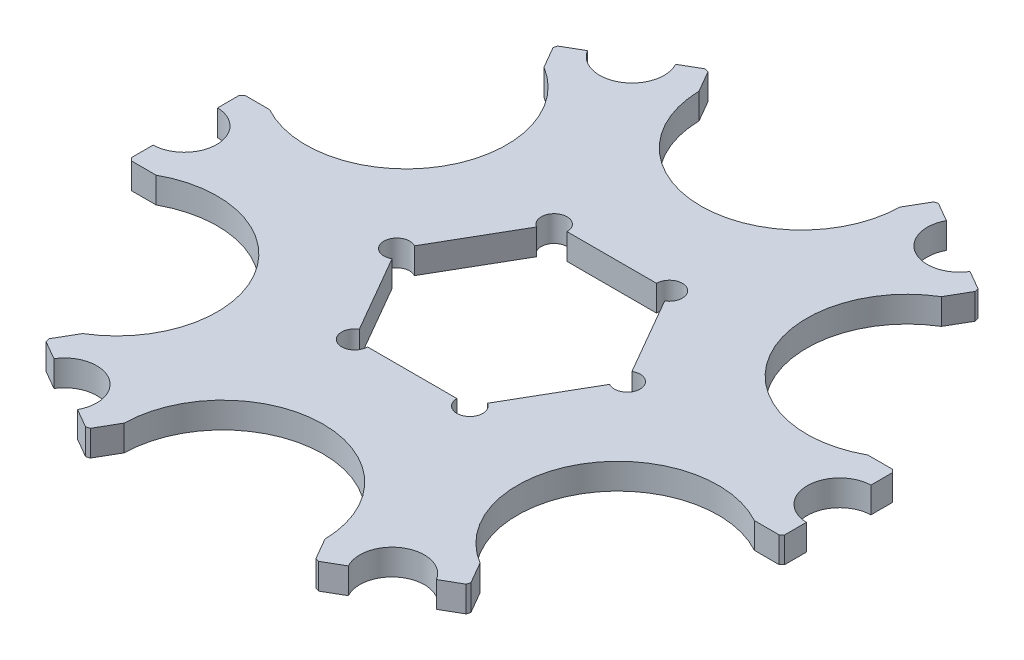
from build123d import *

# Parameters (mm, degrees)
BOSS_EXTRUDE1_DEPTH = 4.7625
CHAMFER1_SIZE       = 0.508


with BuildPart() as part:
    # Sketch1 → Boss-Extrude1 (new body)
    with BuildSketch(Plane(origin=(0, 0, 0), x_dir=(1, 0, 0), z_dir=(0, 1, 0))):
        with BuildLine():
            Line((-55.1561, 10.4648), (-60.2361, 10.4648))
            Line((-60.2361, 10.4648), (-60.2361, 5.950469261))
            ThreePointArc((-60.2361, 5.950469261), (-54.460775, 0), (-60.2361, -5.950469261))
            Line((-60.2361, -5.950469261), (-60.2361, -10.4648))
            Line((-60.2361, -10.4648), (-55.1561, -10.4648))
            ThreePointArc((-55.1561, -10.4648), (-30.156383683, -17.410796237), (-36.640832646, -42.534183774))
            Line((-36.640832646, -42.534183774), (-39.180832646, -46.933592825))
            Line((-39.180832646, -46.933592825), (-35.271307544, -49.190758194))
            ThreePointArc((-35.271307544, -49.190758194), (-27.2303875, -47.16441466), (-24.964792456, -55.141227455))
            Line((-24.964792456, -55.141227455), (-21.055267354, -57.398392825))
            Line((-21.055267354, -57.398392825), (-18.515267354, -52.998983774))
            ThreePointArc((-18.515267354, -52.998983774), (0, -34.821592475), (18.515267354, -52.998983774))
            Line((18.515267354, -52.998983774), (21.055267354, -57.398392825))
            Line((21.055267354, -57.398392825), (24.964792456, -55.141227455))
            ThreePointArc((24.964792456, -55.141227455), (27.2303875, -47.16441466), (35.271307544, -49.190758194))
            Line((35.271307544, -49.190758194), (39.180832646, -46.933592825))
            Line((39.180832646, -46.933592825), (36.640832646, -42.534183774))
            ThreePointArc((36.640832646, -42.534183774), (30.156383683, -17.410796237), (55.1561, -10.4648))
            Line((55.1561, -10.4648), (60.2361, -10.4648))
            Line((60.2361, -10.4648), (60.2361, -5.950469261))
            ThreePointArc((60.2361, -5.950469261), (54.460775, 0), (60.2361, 5.950469261))
            Line((60.2361, 5.950469261), (60.2361, 10.4648))
            Line((60.2361, 10.4648), (55.1561, 10.4648))
            ThreePointArc((55.1561, 10.4648), (30.156383683, 17.410796237), (36.640832646, 42.534183774))
            Line((36.640832646, 42.534183774), (39.180832646, 46.933592825))
            Line((39.180832646, 46.933592825), (35.271307544, 49.190758194))
            ThreePointArc((35.271307544, 49.190758194), (27.2303875, 47.16441466), (24.964792456, 55.141227455))
            Line((24.964792456, 55.141227455), (21.055267354, 57.398392825))
            Line((21.055267354, 57.398392825), (18.515267354, 52.998983774))
            ThreePointArc((18.515267354, 52.998983774), (0, 34.821592475), (-18.515267354, 52.998983774))
            Line((-18.515267354, 52.998983774), (-21.055267354, 57.398392825))
            Line((-21.055267354, 57.398392825), (-24.964792456, 55.141227455))
            ThreePointArc((-24.964792456, 55.141227455), (-27.2303875, 47.16441466), (-35.271307544, 49.190758194))
            Line((-35.271307544, 49.190758194), (-39.180832646, 46.933592825))
            Line((-39.180832646, 46.933592825), (-36.640832646, 42.534183774))
            ThreePointArc((-36.640832646, 42.534183774), (-30.156383683, 17.410796237), (-55.1561, 10.4648))
        make_face()
        with BuildLine():
            ThreePointArc((-11.815197859, 16.340077007), (-11.815197859, 20.464522993), (-8.243322859, 18.4023))
            Line((-8.243322859, 18.4023), (8.243322859, 18.4023))
            ThreePointArc((8.243322859, 18.4023), (10.624572859, 20.78355), (13.005822859, 18.4023))
            ThreePointArc((13.005822859, 18.4023), (12.686795851, 17.211675), (11.815197859, 16.340077007))
            Line((11.815197859, 16.340077007), (20.058520717, 2.062222993))
            ThreePointArc((20.058520717, 2.062222993), (22.439770717, 2.062222993), (23.630395717, 0))
            ThreePointArc((23.630395717, 0), (22.439770717, -2.062222993), (20.058520717, -2.062222993))
            Line((20.058520717, -2.062222993), (11.815197859, -16.340077007))
            ThreePointArc((11.815197859, -16.340077007), (12.686795851, -17.211675), (13.005822859, -18.4023))
            ThreePointArc((13.005822859, -18.4023), (10.624572859, -20.78355), (8.243322859, -18.4023))
            Line((8.243322859, -18.4023), (-8.243322859, -18.4023))
            ThreePointArc((-8.243322859, -18.4023), (-11.815197859, -20.464522993), (-11.815197859, -16.340077007))
            Line((-11.815197859, -16.340077007), (-20.058520717, -2.062222993))
            ThreePointArc((-20.058520717, -2.062222993), (-23.630395717, 0), (-20.058520717, 2.062222993))
            Line((-20.058520717, 2.062222993), (-11.815197859, 16.340077007))
        make_face(mode=Mode.SUBTRACT)
    extrude(amount=BOSS_EXTRUDE1_DEPTH)

    # Chamfer1
    chamfer1_edges = [part.edges().sort_by_distance(p)[0] for p in [
        (-60.2361, 2.38125, 10.4648),
        (-39.180832646, 2.38125, 46.933592825),
        (-21.055267354, 2.38125, 57.398392825),
        (21.055267354, 2.38125, 57.398392825),
        (39.180832646, 2.38125, 46.933592825),
        (60.2361, 2.38125, 10.4648),
        (60.2361, 2.38125, -10.4648),
        (39.180832646, 2.38125, -46.933592825),
        (21.055267354, 2.38125, -57.398392825),
        (-21.055267354, 2.38125, -57.398392825),
        (-39.180832646, 2.38125, -46.933592825),
        (-60.2361, 2.38125, -10.4648),
    ]]
    chamfer(chamfer1_edges, length=CHAMFER1_SIZE)


solid = part.part
